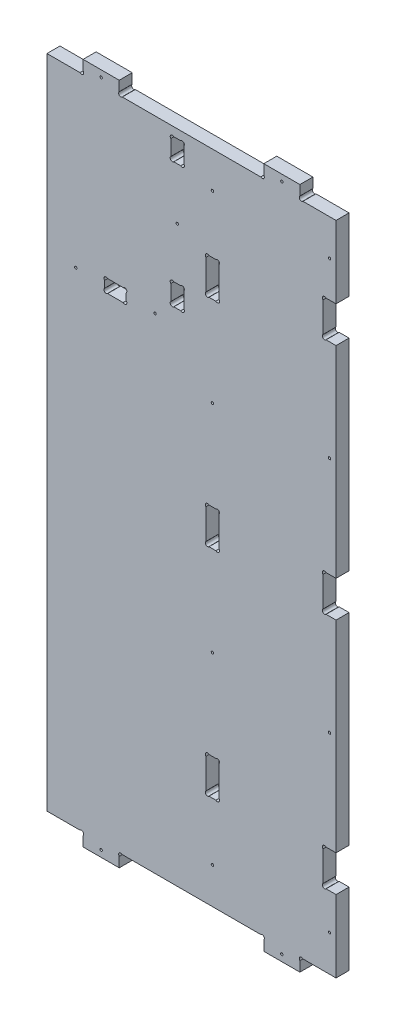
from build123d import *

# Parameters (mm, degrees)
SKETCH1_W             = 400
SKETCH1_H             = 943.901471862
BOSS_EXTRUDE1_DEPTH   = 18
CAVITY1_START         = -439.427247466
CAVITY1_OUTLINE_W     = 50
CAVITY1_OUTLINE_H     = 18
CAVITY1_OUTLINE_W_2   = 200
CAVITY1_DEPTH         = 18
CAVITY1_START_2       = 486.474224396
CAVITY1_2_OUTLINE_W   = 50
CAVITY1_2_OUTLINE_H   = 18
CAVITY1_2_OUTLINE_W_2 = 200
CAVITY1_2_DEPTH       = 18
CAVITY1_START_3       = 7.523488465
CAVITY1_3_OUTLINE_W   = 18
CAVITY1_3_OUTLINE_H   = 18
CAVITY1_3_DEPTH       = 50
CAVITY1_START_4       = -321.427247466
CAVITY1_4_OUTLINE_W   = 18
CAVITY1_4_OUTLINE_H   = 18
CAVITY1_4_DEPTH       = 50
CAVITY1_START_5       = -291.427247466
CAVITY1_5_OUTLINE_W   = 18
CAVITY1_5_OUTLINE_H   = 18
CAVITY1_5_DEPTH       = 50
CAVITY1_START_6       = 306.474224396
CAVITY1_6_OUTLINE_W   = 18
CAVITY1_6_OUTLINE_H   = 18
CAVITY1_6_DEPTH       = 50
CAVITY1_START_7       = 336.474224396
CAVITY1_7_OUTLINE_W   = 18
CAVITY1_7_OUTLINE_H   = 18
CAVITY1_7_DEPTH       = 50
CAVITY1_START_8       = 240.724224396
CAVITY1_8_OUTLINE_W   = 30
CAVITY1_8_OUTLINE_H   = 18
CAVITY1_8_DEPTH       = 18
CAVITY1_START_9       = 270.724224396
CAVITY1_9_OUTLINE_W   = 18
CAVITY1_9_OUTLINE_H   = 18
CAVITY1_9_DEPTH       = 30
CAVITY1_START_10      = 444.474224396
CAVITY1_10_OUTLINE_W  = 18
CAVITY1_10_OUTLINE_H  = 18
CAVITY1_10_DEPTH      = 30
SKETCH3_R             = 3
CUT_EXTRUDE1_DEPTH    = 18
M3_CLEARANCE_HOLE1_D  = 3.4


# Read off the part's stored shape, not the designer's step: Cavity1
with BuildPart() as part:
    # Sketch1 → Boss-Extrude1 (new body)
    with BuildSketch(Plane.XY):
        with Locations((173.181479905, 32.523488465)):
            Rectangle(SKETCH1_W, SKETCH1_H)
    extrude(amount=BOSS_EXTRUDE1_DEPTH)

    # Cavity1 outline → Cavity1 (cut)
    with BuildSketch(Plane(origin=(0, 0, 0), x_dir=(1, 0, 0), z_dir=(0, 1, 0)).offset(CAVITY1_START)):
        with Locations((-1.818520095, -9)):
            Rectangle(CAVITY1_OUTLINE_W, CAVITY1_OUTLINE_H)
        with Locations((173.181479905, -9)):
            Rectangle(CAVITY1_OUTLINE_W_2, CAVITY1_OUTLINE_H)
        with Locations((348.181479905, -9)):
            Rectangle(CAVITY1_OUTLINE_W, CAVITY1_OUTLINE_H)
    extrude(amount=CAVITY1_DEPTH, mode=Mode.SUBTRACT)

    # Cavity1 2 outline → Cavity1 2 (cut)
    with BuildSketch(Plane(origin=(0, 0, 0), x_dir=(1, 0, 0), z_dir=(0, 1, 0)).offset(CAVITY1_START_2)):
        with Locations((-1.818520095, -9)):
            Rectangle(CAVITY1_2_OUTLINE_W, CAVITY1_2_OUTLINE_H)
        with Locations((173.181479905, -9)):
            Rectangle(CAVITY1_2_OUTLINE_W_2, CAVITY1_2_OUTLINE_H)
        with Locations((348.181479905, -9)):
            Rectangle(CAVITY1_2_OUTLINE_W, CAVITY1_2_OUTLINE_H)
    extrude(amount=CAVITY1_2_DEPTH, mode=Mode.SUBTRACT)

    # Cavity1 3 outline → Cavity1 3 (cut)
    with BuildSketch(Plane(origin=(0, 0, 0), x_dir=(1, 0, 0), z_dir=(0, 1, 0)).offset(CAVITY1_START_3)):
        with Locations((202.181479905, -9)):
            Rectangle(CAVITY1_3_OUTLINE_W, CAVITY1_3_OUTLINE_H)
        with Locations((364.181479905, -9)):
            Rectangle(CAVITY1_3_OUTLINE_W, CAVITY1_3_OUTLINE_H)
    extrude(amount=CAVITY1_3_DEPTH, mode=Mode.SUBTRACT)

    # Cavity1 4 outline → Cavity1 4 (cut)
    with BuildSketch(Plane(origin=(0, 0, 0), x_dir=(1, 0, 0), z_dir=(0, 1, 0)).offset(CAVITY1_START_4)):
        with Locations((364.181479905, -9)):
            Rectangle(CAVITY1_4_OUTLINE_W, CAVITY1_4_OUTLINE_H)
    extrude(amount=CAVITY1_4_DEPTH, mode=Mode.SUBTRACT)

    # Cavity1 5 outline → Cavity1 5 (cut)
    with BuildSketch(Plane(origin=(0, 0, 0), x_dir=(1, 0, 0), z_dir=(0, 1, 0)).offset(CAVITY1_START_5)):
        with Locations((202.181479905, -9)):
            Rectangle(CAVITY1_5_OUTLINE_W, CAVITY1_5_OUTLINE_H)
    extrude(amount=CAVITY1_5_DEPTH, mode=Mode.SUBTRACT)

    # Cavity1 6 outline → Cavity1 6 (cut)
    with BuildSketch(Plane(origin=(0, 0, 0), x_dir=(1, 0, 0), z_dir=(0, 1, 0)).offset(CAVITY1_START_6)):
        with Locations((202.181479905, -9)):
            Rectangle(CAVITY1_6_OUTLINE_W, CAVITY1_6_OUTLINE_H)
    extrude(amount=CAVITY1_6_DEPTH, mode=Mode.SUBTRACT)

    # Cavity1 7 outline → Cavity1 7 (cut)
    with BuildSketch(Plane(origin=(0, 0, 0), x_dir=(1, 0, 0), z_dir=(0, 1, 0)).offset(CAVITY1_START_7)):
        with Locations((364.181479905, -9)):
            Rectangle(CAVITY1_7_OUTLINE_W, CAVITY1_7_OUTLINE_H)
    extrude(amount=CAVITY1_7_DEPTH, mode=Mode.SUBTRACT)

    # Cavity1 8 outline → Cavity1 8 (cut)
    with BuildSketch(Plane(origin=(0, 0, 0), x_dir=(1, 0, 0), z_dir=(0, 1, 0)).offset(CAVITY1_START_8)):
        with Locations((67.856479905, -9)):
            Rectangle(CAVITY1_8_OUTLINE_W, CAVITY1_8_OUTLINE_H)
    extrude(amount=CAVITY1_8_DEPTH, mode=Mode.SUBTRACT)

    # Cavity1 9 outline → Cavity1 9 (cut)
    with BuildSketch(Plane(origin=(0, 0, 0), x_dir=(1, 0, 0), z_dir=(0, 1, 0)).offset(CAVITY1_START_9)):
        with Locations((153.531479905, -9)):
            Rectangle(CAVITY1_9_OUTLINE_W, CAVITY1_9_OUTLINE_H)
    extrude(amount=CAVITY1_9_DEPTH, mode=Mode.SUBTRACT)

    # Cavity1 10 outline → Cavity1 10 (cut)
    with BuildSketch(Plane(origin=(0, 0, 0), x_dir=(1, 0, 0), z_dir=(0, 1, 0)).offset(CAVITY1_START_10)):
        with Locations((153.531479905, -9)):
            Rectangle(CAVITY1_10_OUTLINE_W, CAVITY1_10_OUTLINE_H)
    extrude(amount=CAVITY1_10_DEPTH, mode=Mode.SUBTRACT)

    # Sketch3 → Cut-Extrude1 (cut)
    with BuildSketch(Plane.XY.offset(18)):
        with Locations((357.302800248, -273.54856781)):
            Circle(SKETCH3_R)
        with Locations((357.302800248, -319.305927123)):
            Circle(SKETCH3_R)
        with Locations((357.302800248, 384.352904053)):
            Circle(SKETCH3_R)
        with Locations((357.302800248, 338.59554474)):
            Circle(SKETCH3_R)
        with Locations((357.302800248, 55.402168121)):
            Circle(SKETCH3_R)
        with Locations((357.302800248, 9.644808808)):
            Circle(SKETCH3_R)
        with Locations((195.302800248, 354.352904053)):
            Circle(SKETCH3_R)
        with Locations((195.302800248, 308.59554474)):
            Circle(SKETCH3_R)
        with Locations((195.302800248, 55.402168121)):
            Circle(SKETCH3_R)
        with Locations((195.302800248, 9.644808808)):
            Circle(SKETCH3_R)
        with Locations((195.302800248, -243.54856781)):
            Circle(SKETCH3_R)
        with Locations((195.302800248, -289.305927123)):
            Circle(SKETCH3_R)
        with Locations((209.060159561, -289.305927123)):
            Circle(SKETCH3_R)
        with Locations((209.060159561, -243.54856781)):
            Circle(SKETCH3_R)
        with Locations((209.060159561, 9.644808808)):
            Circle(SKETCH3_R)
        with Locations((209.060159561, 55.402168121)):
            Circle(SKETCH3_R)
        with Locations((209.060159561, 308.59554474)):
            Circle(SKETCH3_R)
        with Locations((209.060159561, 354.352904053)):
            Circle(SKETCH3_R)
        with Locations((146.652800248, 472.352904053)):
            Circle(SKETCH3_R)
        with Locations((160.410159561, 472.352904053)):
            Circle(SKETCH3_R)
        with Locations((146.652800248, 446.59554474)):
            Circle(SKETCH3_R)
        with Locations((160.410159561, 446.59554474)):
            Circle(SKETCH3_R)
        with Locations((146.652800248, 298.602904053)):
            Circle(SKETCH3_R)
        with Locations((160.410159561, 298.602904053)):
            Circle(SKETCH3_R)
        with Locations((146.652800248, 272.84554474)):
            Circle(SKETCH3_R)
        with Locations((160.410159561, 272.84554474)):
            Circle(SKETCH3_R)
        with Locations((54.977800248, 256.602904053)):
            Circle(SKETCH3_R)
        with Locations((80.735159561, 256.602904053)):
            Circle(SKETCH3_R)
        with Locations((54.977800248, 242.84554474)):
            Circle(SKETCH3_R)
        with Locations((80.735159561, 242.84554474)):
            Circle(SKETCH3_R)
        with Locations((325.302800248, 488.59554474)):
            Circle(SKETCH3_R)
        with Locations((271.060159561, 488.59554474)):
            Circle(SKETCH3_R)
        with Locations((75.302800248, 488.59554474)):
            Circle(SKETCH3_R)
        with Locations((21.060159561, 488.59554474)):
            Circle(SKETCH3_R)
        with Locations((21.060159561, -423.54856781)):
            Circle(SKETCH3_R)
        with Locations((75.302800248, -423.54856781)):
            Circle(SKETCH3_R)
        with Locations((271.060159561, -423.54856781)):
            Circle(SKETCH3_R)
        with Locations((325.302800248, -423.54856781)):
            Circle(SKETCH3_R)
    extrude(amount=-CUT_EXTRUDE1_DEPTH, mode=Mode.SUBTRACT)

    # M3 Clearance Hole1 (through all)
    with Locations(Plane(origin=(0, 0, 0), x_dir=(-1, 0, 0), z_dir=(0, 0, -1))):
        with Locations((-48.181479905, 495.474224396), (-298.181479905, 495.474224396), (-298.181479905, -430.427247466), (-48.181479905, -430.427247466), (-153.531479905, 372.599224396), (-13.018979905, 249.724224396), (-122.693979905, 249.724224396), (-364.181479905, 436.474224396), (-364.181479905, 196.99885643), (-364.181479905, -131.951879501), (-364.181479905, -371.427247466), (-202.181479905, -371.427247466), (-202.181479905, -116.951879501), (-202.181479905, 181.99885643), (-202.181479905, 436.474224396)):
            Hole(M3_CLEARANCE_HOLE1_D / 2)


solid = part.part
